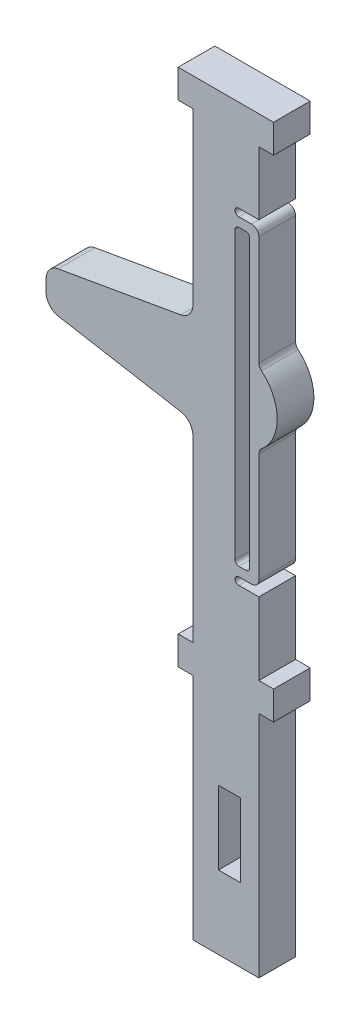
from build123d import *

# Parameters (mm, degrees)
SKETCH1_W           = 2
SKETCH1_H           = 40
SKETCH1_W_2         = 3
SKETCH1_H_2         = 10
BOSS_EXTRUDE1_DEPTH = 2.5
FILLET1_R           = 0.5
FILLET2_R           = 1
FILLET3_R           = 1
FILLET4_R           = 2


with BuildPart() as part:
    # Sketch1 → Boss-Extrude1 (new, symmetric)
    with BuildSketch(Plane.XY):
        with BuildLine():
            Line((-18.6, 166.579989158), (-18.6, 182.956591985))
            Line((-18.6, 182.956591985), (-21.85, 182.956591985))
            Line((-21.85, 182.956591985), (-21.85, 183.956591985))
            Line((-21.85, 183.956591985), (-18.6, 183.956591985))
            Line((-18.6, 183.956591985), (-18.6, 192.579989158))
            Line((-18.6, 192.579989158), (-16.6, 192.579989158))
            Line((-16.6, 192.579989158), (-16.6, 196.474649456))
            Line((-16.6, 196.474649456), (-29.6, 196.474649456))
            Line((-29.6, 196.474649456), (-29.6, 192.579989158))
            Line((-29.6, 192.579989158), (-27.6, 192.579989158))
            Line((-27.6, 192.579989158), (-27.6, 167.706591985))
            Line((-27.6, 167.706591985), (-47.6, 164.206591985))
            Line((-47.6, 164.206591985), (-47.6, 159.206591985))
            Line((-47.6, 159.206591985), (-27.6, 155.706591985))
            Line((-27.6, 155.706591985), (-27.6, 129.579989158))
            Line((-27.6, 129.579989158), (-29.6, 129.579989158))
            Line((-29.6, 129.579989158), (-29.6, 125.685328859))
            Line((-29.6, 125.685328859), (-27.6, 125.685328859))
            Line((-27.6, 125.685328859), (-27.6, 94.474649456))
            Line((-27.6, 94.474649456), (-18.6, 94.474649456))
            Line((-18.6, 94.474649456), (-18.6, 125.685328859))
            Line((-18.6, 125.685328859), (-16.6, 125.685328859))
            Line((-16.6, 125.685328859), (-16.6, 129.579989158))
            Line((-16.6, 129.579989158), (-18.6, 129.579989158))
            Line((-18.6, 129.579989158), (-18.6, 139.456591985))
            Line((-18.6, 139.456591985), (-21.85, 139.456591985))
            Line((-21.85, 139.456591985), (-21.85, 140.456591985))
            Line((-21.85, 140.456591985), (-18.6, 140.456591985))
            Line((-18.6, 140.456591985), (-18.6, 156.833194813))
            ThreePointArc((-18.6, 156.833194813), (-16.1, 161.706591985), (-18.6, 166.579989158))
        make_face()
        with Locations((-20.85, 161.706591985)):
            Rectangle(SKETCH1_W, SKETCH1_H, mode=Mode.SUBTRACT)
        with Locations((-22.6, 109.474649456)):
            Rectangle(SKETCH1_W_2, SKETCH1_H_2, mode=Mode.SUBTRACT)
    extrude(amount=BOSS_EXTRUDE1_DEPTH, both=True)

    # Fillet1
    fillet1_edges = [part.edges().sort_by_distance(p)[0] for p in [
        (-21.85, 183.956591985, 0),
        (-21.85, 182.956591985, 0),
        (-21.85, 140.456591985, 0),
        (-21.85, 139.456591985, 0),
        (-21.85, 181.706591985, 0),
        (-21.85, 141.706591985, 0),
        (-19.85, 141.706591985, 0),
        (-19.85, 181.706591985, 0),
    ]]
    fillet(fillet1_edges, radius=FILLET1_R - 0.0001)  # a hair under: the kernel refuses the full size

    # Fillet2
    fillet2_edges = [part.edges().sort_by_distance(p)[0] for p in [
        (-18.6, 182.956591985, 0),
        (-18.6, 140.456591985, 0),
    ]]
    fillet(fillet2_edges, radius=FILLET2_R)

    # Fillet3
    fillet3_edges = [part.edges().sort_by_distance(p)[0] for p in [
        (-18.6, 166.579989158, 0),
        (-18.6, 156.833194813, 0),
    ]]
    fillet(fillet3_edges, radius=FILLET3_R)

    # Fillet4
    fillet4_edges = [part.edges().sort_by_distance(p)[0] for p in [
        (-27.6, 155.706591985, 0),
        (-47.6, 159.206591985, 0),
        (-47.6, 164.206591985, 0),
        (-27.6, 167.706591985, 0),
    ]]
    fillet(fillet4_edges, radius=FILLET4_R)


solid = part.part
